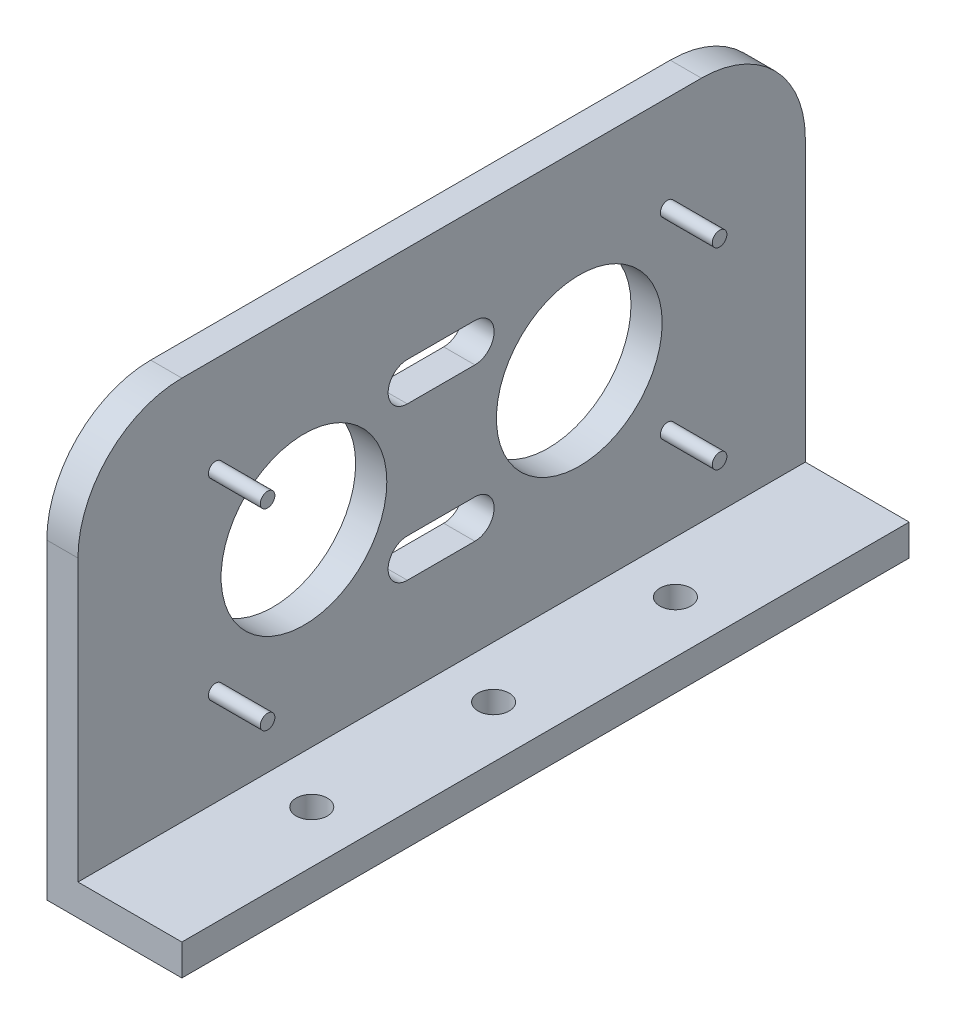
from build123d import *

# Parameters (mm, degrees)
BOSS_EXTRUDE1_DEPTH = 70
SKETCH2_R           = 7.975
CUT_EXTRUDE9_DEPTH  = 82.240384046
SKETCH2_12_R        = 7.975
CUT_EXTRUDE10_DEPTH = 82.240384046
FILLET1_R           = 10
FILLET2_R           = 10
SKETCH3_R           = 1.5
CUT_EXTRUDE11_DEPTH = 81.237148504
CUT_EXTRUDE12_DEPTH = 82.663945533
SKETCH6_R           = 0.7
BOSS_EXTRUDE2_DEPTH = 8


# Read off the part's stored shape, not the designer's step: Boss-Extrude1
with BuildPart() as part:
    # Boss-Extrude1 outline → Boss-Extrude1 (new body)
    with BuildSketch(Plane.XY):
        Polygon((-10, 40), (-13, 40), (-13, 0), (0, 0), (0, 3), (-10, 3), align=None)
    extrude(amount=BOSS_EXTRUDE1_DEPTH)

    # Sketch2 → Cut-Extrude9 (cut, through all)
    with BuildSketch(Plane(origin=(-10, 0, 0), x_dir=(0, 0, -1), z_dir=(1, 0, 0))):
        with Locations((-48.25, 21.5)):
            Circle(SKETCH2_R)
    extrude(amount=-CUT_EXTRUDE9_DEPTH, mode=Mode.SUBTRACT)

    # Sketch2<12> → Cut-Extrude10 (cut, through all)
    with BuildSketch(Plane(origin=(-10, 0, 0), x_dir=(0, 0, -1), z_dir=(1, 0, 0))):
        with Locations((-21.75, 21.5)):
            Circle(SKETCH2_12_R)
    extrude(amount=-CUT_EXTRUDE10_DEPTH, mode=Mode.SUBTRACT)

    # Fillet1
    fillet1_edges = [part.edges().sort_by_distance(p)[0] for p in [
        (-11.5, 40, 70),
    ]]
    fillet(fillet1_edges, radius=FILLET1_R)

    # Fillet2
    fillet2_edges = [part.edges().sort_by_distance(p)[0] for p in [
        (-11.5, 40, 0),
    ]]
    fillet(fillet2_edges, radius=FILLET2_R)

    # Sketch3 → Cut-Extrude11 (cut, through all)
    with BuildSketch(Plane(origin=(0, 3, 0), x_dir=(1, 0, 0), z_dir=(0, 1, 0))):
        with Locations(Location((-5, -35, 0), (0, 0, 270))):
            Circle(SKETCH3_R)
        with Locations(Location((-5, -52.5, 0), (0, 0, 270))):
            Circle(SKETCH3_R)
        with Locations(Location((-5, -17.5, 0), (0, 0, 270))):
            Circle(SKETCH3_R)
    extrude(amount=-CUT_EXTRUDE11_DEPTH, mode=Mode.SUBTRACT)

    # Sketch4 → Cut-Extrude12 (cut, through all)
    with BuildSketch(Plane.ZY.offset(13)):
        with BuildLine():
            Line((38.3, 27), (31.8, 27))
            ThreePointArc((31.8, 27), (29.95, 28.85), (31.8, 30.7))
            Line((31.8, 30.7), (38.3, 30.7))
            ThreePointArc((38.3, 30.7), (40.15, 28.85), (38.3, 27))
        make_face()
        with BuildLine():
            Line((38.3, 16), (31.8, 16))
            ThreePointArc((31.8, 16), (29.95, 14.15), (31.8, 12.3))
            Line((31.8, 12.3), (38.3, 12.3))
            ThreePointArc((38.3, 12.3), (40.15, 14.15), (38.3, 16))
        make_face()
    extrude(amount=-CUT_EXTRUDE12_DEPTH, mode=Mode.SUBTRACT)

    # Sketch6 → Boss-Extrude2 (add)
    with BuildSketch(Plane.ZY.offset(13)):
        with Locations(Location((56.75, 30.75, 0), (0, 0, 270))):
            Circle(SKETCH6_R)
        with Locations(Location((56.75, 12.25, 0), (0, 0, 270))):
            Circle(SKETCH6_R)
        with Locations(Location((13.25, 30.75, 0), (0, 0, 270))):
            Circle(SKETCH6_R)
        with Locations(Location((13.25, 12.25, 0), (0, 0, 270))):
            Circle(SKETCH6_R)
    extrude(amount=-BOSS_EXTRUDE2_DEPTH)


solid = part.part
